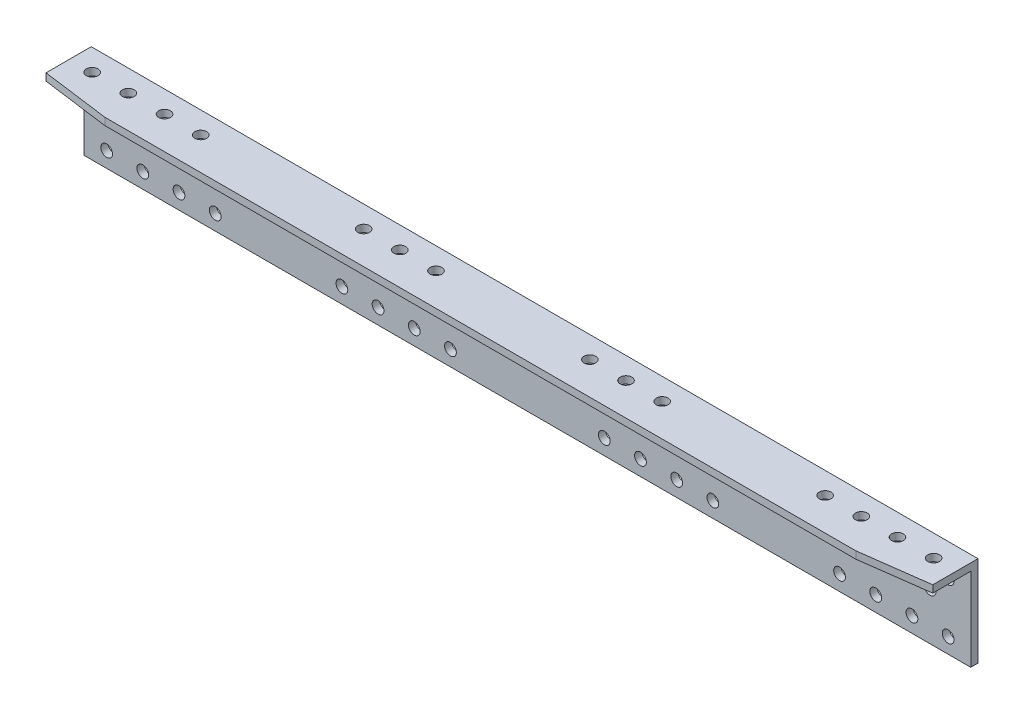
from build123d import *

# Parameters (mm, degrees)
SKETCH_1_W          = 1960
SKETCH_1_H          = 200
SKETCH_1_R          = 13
EXTRUDE_1612_DEPTH  = 16
SKETCH_2_W          = 1960
SKETCH_2_H          = 16
EXTRUDE_1_DEPTH     = 104
SKETCH_3_R          = 13
CUT_EXTRUDE_1_DEPTH = 1008.372820757


with BuildPart() as part:
    # 草图1 → Extrude 1612 (new body)
    with BuildSketch(Plane.XY):
        with Locations((0, 100)):
            Rectangle(SKETCH_1_W, SKETCH_1_H)
        with Locations((930, 146)):
            Circle(SKETCH_1_R, mode=Mode.SUBTRACT)
        with Locations((-890, 106)):
            Circle(SKETCH_1_R, mode=Mode.SUBTRACT)
        with Locations((850, 146)):
            Circle(SKETCH_1_R, mode=Mode.SUBTRACT)
        with Locations((930, 34)):
            Circle(SKETCH_1_R, mode=Mode.SUBTRACT)
        with Locations((850, 34)):
            Circle(SKETCH_1_R, mode=Mode.SUBTRACT)
        with Locations((-810, 106)):
            Circle(SKETCH_1_R, mode=Mode.SUBTRACT)
        with Locations((770, 34)):
            Circle(SKETCH_1_R, mode=Mode.SUBTRACT)
        with Locations((770, 146)):
            Circle(SKETCH_1_R, mode=Mode.SUBTRACT)
        with Locations((-730, 106)):
            Circle(SKETCH_1_R, mode=Mode.SUBTRACT)
        with Locations((690, 146)):
            Circle(SKETCH_1_R, mode=Mode.SUBTRACT)
        with Locations((690, 34)):
            Circle(SKETCH_1_R, mode=Mode.SUBTRACT)
        with Locations((-650, 106)):
            Circle(SKETCH_1_R, mode=Mode.SUBTRACT)
        with Locations((170, 146)):
            Circle(SKETCH_1_R, mode=Mode.SUBTRACT)
        with Locations((170, 34)):
            Circle(SKETCH_1_R, mode=Mode.SUBTRACT)
        with Locations((-410, 146)):
            Circle(SKETCH_1_R, mode=Mode.SUBTRACT)
        with Locations((250, 34)):
            Circle(SKETCH_1_R, mode=Mode.SUBTRACT)
        with Locations((250, 146)):
            Circle(SKETCH_1_R, mode=Mode.SUBTRACT)
        with Locations((-450, 106)):
            Circle(SKETCH_1_R, mode=Mode.SUBTRACT)
        with Locations((330, 34)):
            Circle(SKETCH_1_R, mode=Mode.SUBTRACT)
        with Locations((330, 146)):
            Circle(SKETCH_1_R, mode=Mode.SUBTRACT)
        with Locations((-370, 106)):
            Circle(SKETCH_1_R, mode=Mode.SUBTRACT)
        with Locations((-290, 106)):
            Circle(SKETCH_1_R, mode=Mode.SUBTRACT)
        with Locations((-210, 106)):
            Circle(SKETCH_1_R, mode=Mode.SUBTRACT)
        with Locations((890, 106)):
            Circle(SKETCH_1_R, mode=Mode.SUBTRACT)
        with Locations((810, 106)):
            Circle(SKETCH_1_R, mode=Mode.SUBTRACT)
        with Locations((650, 106)):
            Circle(SKETCH_1_R, mode=Mode.SUBTRACT)
        with Locations((730, 106)):
            Circle(SKETCH_1_R, mode=Mode.SUBTRACT)
        with Locations((-330, 146)):
            Circle(SKETCH_1_R, mode=Mode.SUBTRACT)
        with Locations((-330, 34)):
            Circle(SKETCH_1_R, mode=Mode.SUBTRACT)
        with Locations((410, 146)):
            Circle(SKETCH_1_R, mode=Mode.SUBTRACT)
        with Locations((-250, 146)):
            Circle(SKETCH_1_R, mode=Mode.SUBTRACT)
        with Locations((-250, 34)):
            Circle(SKETCH_1_R, mode=Mode.SUBTRACT)
        with Locations((450, 106)):
            Circle(SKETCH_1_R, mode=Mode.SUBTRACT)
        with Locations((-170, 34)):
            Circle(SKETCH_1_R, mode=Mode.SUBTRACT)
        with Locations((-170, 146)):
            Circle(SKETCH_1_R, mode=Mode.SUBTRACT)
        with Locations((370, 106)):
            Circle(SKETCH_1_R, mode=Mode.SUBTRACT)
        with Locations((-690, 146)):
            Circle(SKETCH_1_R, mode=Mode.SUBTRACT)
        with Locations((290, 106)):
            Circle(SKETCH_1_R, mode=Mode.SUBTRACT)
        with Locations((-770, 146)):
            Circle(SKETCH_1_R, mode=Mode.SUBTRACT)
        with Locations((210, 106)):
            Circle(SKETCH_1_R, mode=Mode.SUBTRACT)
        with Locations((-850, 146)):
            Circle(SKETCH_1_R, mode=Mode.SUBTRACT)
        with Locations((130, 106)):
            Circle(SKETCH_1_R, mode=Mode.SUBTRACT)
        with Locations((-930, 146)):
            Circle(SKETCH_1_R, mode=Mode.SUBTRACT)
        with Locations((-690, 34)):
            Circle(SKETCH_1_R, mode=Mode.SUBTRACT)
        with Locations((-770, 34)):
            Circle(SKETCH_1_R, mode=Mode.SUBTRACT)
        with Locations((-850, 34)):
            Circle(SKETCH_1_R, mode=Mode.SUBTRACT)
        with Locations((-930, 34)):
            Circle(SKETCH_1_R, mode=Mode.SUBTRACT)
        with Locations((-130, 106)):
            Circle(SKETCH_1_R, mode=Mode.SUBTRACT)
        with Locations((410, 34)):
            Circle(SKETCH_1_R, mode=Mode.SUBTRACT)
        with Locations((-410, 34)):
            Circle(SKETCH_1_R, mode=Mode.SUBTRACT)
    extrude(amount=EXTRUDE_1612_DEPTH)

    # 草图2 → 凸台-拉伸1 (add)
    with BuildSketch(Plane.XY.offset(16)):
        with Locations((0, 192)):
            Rectangle(SKETCH_2_W, SKETCH_2_H)
    extrude(amount=EXTRUDE_1_DEPTH)

    # 草图3 → 切除-拉伸1 (cut, through all)
    with BuildSketch(Plane(origin=(0, 200, 0), x_dir=(-1, 0, 0), z_dir=(0, 1, 0))):
        with Locations((-930, 48)):
            Circle(SKETCH_3_R)
        with Locations((-850, 48)):
            Circle(SKETCH_3_R)
        with Locations((-770, 48)):
            Circle(SKETCH_3_R)
        with Locations((-690, 48)):
            Circle(SKETCH_3_R)
        with Locations((-330, 48)):
            Circle(SKETCH_3_R)
        with Locations((-250, 48)):
            Circle(SKETCH_3_R)
        with Locations((-170, 48)):
            Circle(SKETCH_3_R)
        with Locations((170, 48)):
            Circle(SKETCH_3_R)
        with Locations((250, 48)):
            Circle(SKETCH_3_R)
        with Locations((330, 48)):
            Circle(SKETCH_3_R)
        with Locations((930, 48)):
            Circle(SKETCH_3_R)
        with Locations((850, 48)):
            Circle(SKETCH_3_R)
        with Locations((770, 48)):
            Circle(SKETCH_3_R)
        with Locations((690, 48)):
            Circle(SKETCH_3_R)
        Polygon((-980, 100), (-830, 120), (-980, 120), align=None)
        Polygon((980, 100), (830, 120), (980, 120), align=None)
    extrude(amount=-CUT_EXTRUDE_1_DEPTH, mode=Mode.SUBTRACT)


solid = part.part
